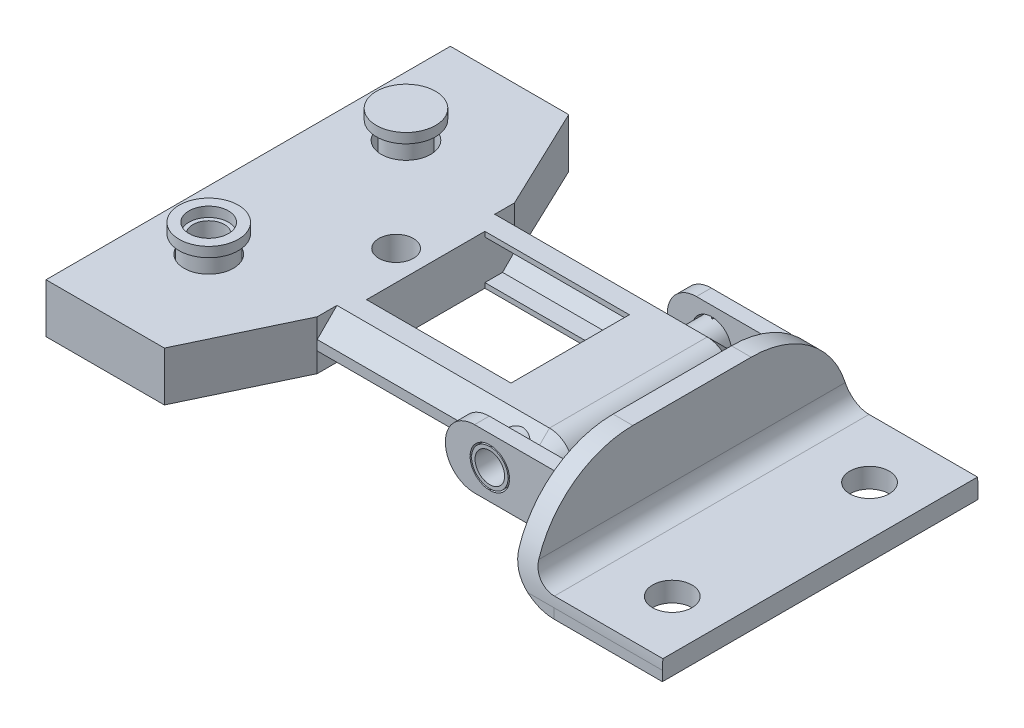
from build123d import *

# Parameters (mm, degrees)
SKETCH1_W                        = 15
SKETCH1_H                        = 32
BASE_FLANGE1_DEPTH               = 2
EDGE_FLANGE1_STRIP_W             = 12
EDGE_FLANGE1_STRIP_H             = 2
EDGE_FLANGE1_STRIP_CUT_DEPTH     = 32
EDGE_FLANGE1_DEPTH               = 32
FILLET1_R                        = 10
BOSS_EXTRUDE1_START              = 10.5
BOSS_EXTRUDE1_DEPTH              = 1.5
SKETCH12_R                       = 2
CUT_EXTRUDE1_DEPTH               = 1.5
F_4_0_4_DIAMETER_HOLE1_OUTLINE_R = 2
F_4_0_4_DIAMETER_HOLE1_DEPTH     = 2
BOSS_EXTRUDE2_DEPTH              = 10
SKETCH20_R                       = 1.85
BOSS_EXTRUDE3_DEPTH              = 12
SKETCH21_W                       = 20
SKETCH21_H                       = 5
BOSS_EXTRUDE4_DEPTH              = 15
FILLET3_SIZE                     = 2
SKETCH22_W                       = 0.147498436
SKETCH22_H                       = 0.1
BOSS_EXTRUDE5_DEPTH              = 1.5
SKETCH22_W_2                     = 0.1
SKETCH22_H_2                     = 0.147498436
BOSS_EXTRUDE5_2_DEPTH            = 1.5
BOSS_EXTRUDE5_3_DEPTH            = 1.5
BOSS_EXTRUDE5_4_DEPTH            = 1.5
SKETCH23_W                       = 0.1
SKETCH23_H                       = 0.147498436
BOSS_EXTRUDE6_DEPTH              = 1.5
SKETCH23_W_2                     = 0.147498436
SKETCH23_H_2                     = 0.1
BOSS_EXTRUDE6_2_DEPTH            = 1.5
BOSS_EXTRUDE6_3_DEPTH            = 1.5
BOSS_EXTRUDE6_4_DEPTH            = 1.5
BOSS_EXTRUDE7_START              = 3.55
BOSS_EXTRUDE7_DEPTH              = 5
F_5_0_START                      = 3.55
F_5_0_5_DIAMETER_HOLE1_OUTLINE_R = 2.5
F_5_0_5_DIAMETER_HOLE1_DEPTH     = 5
SKETCH33_R                       = 1.5
CUT_EXTRUDE2_DEPTH               = 24
SKETCH34_R                       = 3.5
SKETCH34_R_2                     = 2.5
CUT_EXTRUDE3_DEPTH               = 2
SKETCH35_R                       = 3
BOSS_EXTRUDE8_DEPTH              = 1.5
BOSS_EXTRUDE8_2_DEPTH            = 1.5
SKETCH36_R                       = 2
BOSS_EXTRUDE9_DEPTH              = 6.3
SKETCH37_R                       = 3
BOSS_EXTRUDE10_DEPTH             = 1
SKETCH38_R                       = 3.5
CUT_EXTRUDE5_DEPTH               = 3.45
SKETCH39_R                       = 2
CUT_EXTRUDE6_DEPTH               = 7.8
SKETCH40_R                       = 2.4
SKETCH40_R_2                     = 1.6
EXTRUDE_THIN1_DEPTH              = 3.35
SKETCH41_R                       = 1.75
CUT_EXTRUDE7_DEPTH               = 10
SKETCH42_W                       = 14.65
SKETCH42_H                       = 12
CUT_EXTRUDE8_DEPTH               = 56.168854453
CUT_EXTRUDE10_DEPTH              = 14.65


# Read off the part's stored shape, not the designer's step: Ø4.0 (4) Diameter Hole1, Ø5.0 (5) Diameter Hole1
# Sheet-metal steps are written as plain solids
with BuildPart() as part:
    # Sketch1 → Base-Flange1 (new body)
    with BuildSketch(Plane(origin=(0, 0, 0), x_dir=(1, 0, 0), z_dir=(0, 1, 0))):
        Rectangle(SKETCH1_W, SKETCH1_H)
    extrude(amount=BASE_FLANGE1_DEPTH)

    # Edge-Flange1 strip (across the edge) → Edge-Flange1 strip cut (cut)
    with BuildSketch(Plane(origin=(-7.5, 2, -16), x_dir=(1, 0, 0), z_dir=(0, 0, 1))):
        with Locations((-2, -1)):
            Rectangle(EDGE_FLANGE1_STRIP_W, EDGE_FLANGE1_STRIP_H)
    extrude(amount=EDGE_FLANGE1_STRIP_CUT_DEPTH, mode=Mode.SUBTRACT)

    # Edge-Flange1 section (across the edge) → Edge-Flange1 (add)
    with BuildSketch(Plane(origin=(-7.5, 2, -16), x_dir=(1, 0, 0), z_dir=(0, 0, 1))):
        with BuildLine():
            Line((0, 2), (0, 9))
            Line((0, 9), (2, 9))
            Line((2, 9), (2, 2))
            ThreePointArc((2, 2), (2.585786438, 0.585786438), (4, 0))
            Line((4, 0), (4, -2))
            ThreePointArc((4, -2), (1.171572875, -0.828427125), (0, 2))
        make_face()
    extrude(amount=EDGE_FLANGE1_DEPTH)

    # Fillet1
    fillet1_edges = [part.edges().sort_by_distance(p)[0] for p in [
        (-6.5, 11, -16),
        (-6.5, 11, 16),
    ]]
    fillet(fillet1_edges, radius=FILLET1_R)

    # Sketch11 → Boss-Extrude1 (add)
    with BuildSketch(Plane.XY.offset(BOSS_EXTRUDE1_START)):
        with BuildLine():
            Line((-15.55, 9.05), (-7.5, 9.05))
            Line((-7.5, 9.05), (-7.5, 4))
            ThreePointArc((-7.5, 4), (-7.471284466, 3.521565374), (-7.385550154, 3.05))
            Line((-7.385550154, 3.05), (-7.5, 3.05))
            Line((-7.5, 3.05), (-15.55, 3.05))
            ThreePointArc((-15.55, 3.05), (-17.635965005, 3.914034995), (-18.5, 6))
            Line((-18.5, 6), (-18.5, 6.1))
            ThreePointArc((-18.5, 6.1), (-17.635965005, 8.185965005), (-15.55, 9.05))
        make_face()
    boss_extrude1 = extrude(amount=BOSS_EXTRUDE1_DEPTH)

    # Sketch12 → Cut-Extrude1 (cut)
    with BuildSketch(Plane.XY.offset(12)):
        with Locations((-14, 6.05)):
            Circle(SKETCH12_R)
    cut_extrude1 = extrude(amount=-CUT_EXTRUDE1_DEPTH, mode=Mode.SUBTRACT)

    # Mirror1: Boss-Extrude1, Cut-Extrude1 across plane
    add(boss_extrude1.mirror(Plane.XY))
    add(cut_extrude1.mirror(Plane.XY), mode=Mode.SUBTRACT)

    # Ø4.0 (4) Diameter Hole1 outline → Ø4.0 (4) Diameter Hole1 (cut)
    with BuildSketch(Plane(origin=(0, 0, 0), x_dir=(1, 0, 0), z_dir=(0, 1, 0))):
        with Locations((2.5, 10)):
            Circle(F_4_0_4_DIAMETER_HOLE1_OUTLINE_R)
        with Locations((2.5, -10)):
            Circle(F_4_0_4_DIAMETER_HOLE1_OUTLINE_R)
    extrude(amount=F_4_0_4_DIAMETER_HOLE1_DEPTH, mode=Mode.SUBTRACT)


with BuildPart() as body_2:
    # Sketch19 → Boss-Extrude2 (new, symmetric)
    with BuildSketch(Plane.XY):
        with BuildLine():
            Line((-18.5, 8.55), (-11.95, 8.55))
            ThreePointArc((-11.95, 8.55), (-10.217588386, 7.832411614), (-9.5, 6.1))
            Line((-9.5, 6.1), (-9.5, 6))
            ThreePointArc((-9.5, 6), (-10.217588386, 4.267588386), (-11.95, 3.55))
            Line((-11.95, 3.55), (-18.5, 3.55))
            Line((-18.5, 3.55), (-18.5, 8.55))
        make_face()
    extrude(amount=BOSS_EXTRUDE2_DEPTH, both=True)

    # Sketch20 → Boss-Extrude3 (add, symmetric)
    with BuildSketch(Plane.XY):
        with Locations((-14, 6.05)):
            Circle(SKETCH20_R)
    extrude(amount=BOSS_EXTRUDE3_DEPTH, both=True)

    # Sketch21 → Boss-Extrude4 (add)
    with BuildSketch(Plane.ZY.offset(18.5)):
        with Locations((0, 6.05)):
            Rectangle(SKETCH21_W, SKETCH21_H)
    extrude(amount=BOSS_EXTRUDE4_DEPTH)

    # Fillet3
    # the kernel refuses this chamfer: 2 mm, written as the material it takes off along each edge
    with BuildSketch(Plane(origin=(-11.95, 6, 10), x_dir=(1, 0, 0), z_dir=(0, 1, 0))) as fillet3_piece_1:
        Polygon((2.45 - FILLET3_SIZE, 0), (2.45, FILLET3_SIZE), (2.45, 0), align=None)
    revolve(axis=Axis((-11.95, 6, 10), (0, 0, -1)), revolution_arc=90, mode=Mode.SUBTRACT)
    with BuildSketch(Plane(origin=(-9.5, 6.1, 10), x_dir=(-0.9996219169112968, 0, 0.027495876610586487), z_dir=(0, -1, 0)), Plane(origin=(-9.5, 6.1, -10), x_dir=(0.027495876610586487, 0, 0.9996219169112968), z_dir=(0, -1, 0))) as fillet3_piece_2:
        Polygon((FILLET3_SIZE * 0.999621916911, FILLET3_SIZE * 0.0274958766106), (-FILLET3_SIZE * 0.0274958766106, FILLET3_SIZE * 0.999621916911), (0, 0), align=None)
    extrude(amount=0.1, mode=Mode.SUBTRACT)
    with BuildSketch(Plane(origin=(-11.95, 6.1, 10), x_dir=(0, 1, 0), z_dir=(-1, 0, 0))) as fillet3_piece_3:
        Polygon((2.45 - FILLET3_SIZE, 0), (2.45, FILLET3_SIZE), (2.45, 0), align=None)
    revolve(axis=Axis((-11.95, 6.1, 10), (0, 0, -1)), revolution_arc=90, mode=Mode.SUBTRACT)
    with BuildSketch(Plane(origin=(-11.95, 8.55, 10), x_dir=(0, -0.9996219169112968, 0.027495876610586487), z_dir=(-1, 0, 0))) as fillet3_piece_4_section:
        Polygon((FILLET3_SIZE * 0.999621916911, -FILLET3_SIZE * 0.0274958766106), (-FILLET3_SIZE * 0.0274958766106, -FILLET3_SIZE * 0.999621916911), (0, 0), align=None)
    fillet3_piece_4 = extrude(amount=26.693365976, mode=Mode.PRIVATE)
    fillet3_piece_4 = fillet3_piece_4 - Plane(origin=(-14, 6.05, 9.32830341), x_dir=(1, 0, 0), z_dir=(0, 0, 1)) * Cylinder(1.85, 62, mode=Mode.PRIVATE)
    add(fillet3_piece_4, mode=Mode.SUBTRACT)
    with BuildSketch(Plane(origin=(-38.643365976, 8.55, -10), x_dir=(0, 0.027495876610586487, 0.9996219169112968), z_dir=(1, 0, 0))) as fillet3_piece_5_section:
        Polygon((FILLET3_SIZE * 0.999621916911, FILLET3_SIZE * 0.0274958766106), (-FILLET3_SIZE * 0.0274958766106, FILLET3_SIZE * 0.999621916911), (0, 0), align=None)
    fillet3_piece_5 = extrude(amount=26.693365976, mode=Mode.PRIVATE)
    fillet3_piece_5 = fillet3_piece_5 - Plane(origin=(-14, 6.05, -9.328303383), x_dir=(1, 0, 0), z_dir=(0, 0, 1)) * Cylinder(1.85, 62, mode=Mode.PRIVATE)
    add(fillet3_piece_5, mode=Mode.SUBTRACT)
    with BuildSketch(Plane(origin=(-11.95, 6.1, -10), x_dir=(0, 1, 0), z_dir=(-1, 0, 0))) as fillet3_piece_6:
        Polygon((2.45, -FILLET3_SIZE), (2.45 - FILLET3_SIZE, 0), (2.45, 0), align=None)
    revolve(axis=Axis((-11.95, 6.1, -10), (0, 0, -1)), revolution_arc=90, mode=Mode.SUBTRACT)
    with BuildSketch(Plane(origin=(-11.95, 6, -10), x_dir=(1, 0, 0), z_dir=(0, 1, 0))) as fillet3_piece_7:
        Polygon((2.45 - FILLET3_SIZE, 0), (2.45, -FILLET3_SIZE), (2.45, 0), align=None)
    revolve(axis=Axis((-11.95, 6, -10), (0, 0, -1)), revolution_arc=90, mode=Mode.SUBTRACT)
    with BuildSketch(Plane(origin=(-38.643365976, 3.55, -10), x_dir=(0, -0.02749587661058627, 0.9996219169112968), z_dir=(1, 0, 0))) as fillet3_piece_8_section:
        Polygon((FILLET3_SIZE * 0.999621916911, -FILLET3_SIZE * 0.0274958766106), (-FILLET3_SIZE * 0.0274958766106, -FILLET3_SIZE * 0.999621916911), (0, 0), align=None)
    fillet3_piece_8 = extrude(amount=26.693365976, mode=Mode.PRIVATE)
    fillet3_piece_8 = fillet3_piece_8 - Plane(origin=(-14, 6.05, -9.328303378), x_dir=(1, 0, 0), z_dir=(0, 0, 1)) * Cylinder(1.85, 62, mode=Mode.PRIVATE)
    add(fillet3_piece_8, mode=Mode.SUBTRACT)
    with BuildSketch(Plane(origin=(-11.95, 3.55, 10), x_dir=(0, -0.027495876610586487, -0.9996219169112968), z_dir=(-1, 0, 0))) as fillet3_piece_9_section:
        Polygon((FILLET3_SIZE * 0.999621916911, -FILLET3_SIZE * 0.0274958766106), (-FILLET3_SIZE * 0.0274958766106, -FILLET3_SIZE * 0.999621916911), (0, 0), align=None)
    fillet3_piece_9 = extrude(amount=26.693365976, mode=Mode.PRIVATE)
    fillet3_piece_9 = fillet3_piece_9 - Plane(origin=(-14, 6.05, 9.328303378), x_dir=(1, 0, 0), z_dir=(0, 0, 1)) * Cylinder(1.85, 62, mode=Mode.PRIVATE)
    add(fillet3_piece_9, mode=Mode.SUBTRACT)

    # Sketch25 → Boss-Extrude7 (add)
    with BuildSketch(Plane(origin=(0, 0, 0), x_dir=(1, 0, 0), z_dir=(0, 1, 0)).offset(BOSS_EXTRUDE7_START)):
        Polygon((-50.5, 20.5), (-38.5, 20.5), (-33.5, 10), (-33.5, -10), (-38.5, -20.5), (-50.5, -20.5), align=None)
    extrude(amount=BOSS_EXTRUDE7_DEPTH)

    # Ø5.0 (5) Diameter Hole1 outline → Ø5.0 (5) Diameter Hole1 (cut)
    with BuildSketch(Plane(origin=(0, 0, 0), x_dir=(1, 0, 0), z_dir=(0, 1, 0)).offset(F_5_0_START)):
        with Locations((-44.5, -10)):
            Circle(F_5_0_5_DIAMETER_HOLE1_OUTLINE_R)
        with Locations((-44.5, 10)):
            Circle(F_5_0_5_DIAMETER_HOLE1_OUTLINE_R)
    extrude(amount=F_5_0_5_DIAMETER_HOLE1_DEPTH, mode=Mode.SUBTRACT)

    # Sketch33 → Cut-Extrude2 (cut)
    with BuildSketch(Plane(origin=(0, 0, -12), x_dir=(-1, 0, 0), z_dir=(0, 0, -1))):
        with Locations((14, 6.05)):
            Circle(SKETCH33_R)
    extrude(amount=-CUT_EXTRUDE2_DEPTH, mode=Mode.SUBTRACT)

    # Sketch34 → Cut-Extrude3 (cut)
    # profile 1 of 2: a face of its own
    with BuildSketch(Plane.XZ.offset(-3.55)):
        with Locations(Location((-44.5, -10, 0), (0, 0, 270))):
            Circle(SKETCH34_R)
        with Locations(Location((-44.5, -10, 0), (0, 0, 90))):
            Circle(SKETCH34_R_2, mode=Mode.SUBTRACT)
    # profile 2 of 2: a face of its own
    with BuildSketch(Plane.XZ.offset(-3.55)):
        with Locations(Location((-44.5, 10, 0), (0, 0, 270))):
            Circle(SKETCH34_R)
        with Locations(Location((-44.5, 10, 0), (0, 0, 90))):
            Circle(SKETCH34_R_2, mode=Mode.SUBTRACT)
    extrude(amount=-CUT_EXTRUDE3_DEPTH, mode=Mode.SUBTRACT)


with BuildPart() as body_3:
    # Sketch22 → Boss-Extrude5 (new body)
    with BuildSketch(Plane(origin=(0, 0, -12), x_dir=(-1, 0, 0), z_dir=(0, 0, -1))):
        with Locations((12.076250782, 6)):
            Rectangle(SKETCH22_W, SKETCH22_H)
    extrude(amount=-BOSS_EXTRUDE5_DEPTH)


with BuildPart() as body_4:
    # Sketch22 → Boss-Extrude5 2 (new body)
    with BuildSketch(Plane(origin=(0, 0, -12), x_dir=(-1, 0, 0), z_dir=(0, 0, -1))):
        with Locations((13.95, 7.973749218)):
            Rectangle(SKETCH22_W_2, SKETCH22_H_2)
    extrude(amount=-BOSS_EXTRUDE5_2_DEPTH)


with BuildPart() as body_5:
    # Sketch22 → Boss-Extrude5 3 (new body)
    with BuildSketch(Plane(origin=(0, 0, -12), x_dir=(-1, 0, 0), z_dir=(0, 0, -1))):
        with Locations((15.923749218, 6.1)):
            Rectangle(SKETCH22_W, SKETCH22_H)
    extrude(amount=-BOSS_EXTRUDE5_3_DEPTH)


with BuildPart() as body_6:
    # Sketch22 → Boss-Extrude5 4 (new body)
    with BuildSketch(Plane(origin=(0, 0, -12), x_dir=(-1, 0, 0), z_dir=(0, 0, -1))):
        with Locations((14.05, 4.126250782)):
            Rectangle(SKETCH22_W_2, SKETCH22_H_2)
    extrude(amount=-BOSS_EXTRUDE5_4_DEPTH)


with BuildPart() as body_7:
    # Sketch23 → Boss-Extrude6 (new body)
    with BuildSketch(Plane.XY.offset(12)):
        with Locations((-13.95, 7.973749218)):
            Rectangle(SKETCH23_W, SKETCH23_H)
    extrude(amount=-BOSS_EXTRUDE6_DEPTH)


with BuildPart() as body_8:
    # Sketch23 → Boss-Extrude6 2 (new body)
    with BuildSketch(Plane.XY.offset(12)):
        with Locations((-12.076250782, 6)):
            Rectangle(SKETCH23_W_2, SKETCH23_H_2)
    extrude(amount=-BOSS_EXTRUDE6_2_DEPTH)


with BuildPart() as body_9:
    # Sketch23 → Boss-Extrude6 3 (new body)
    with BuildSketch(Plane.XY.offset(12)):
        with Locations((-14.05, 4.126250782)):
            Rectangle(SKETCH23_W, SKETCH23_H)
    extrude(amount=-BOSS_EXTRUDE6_3_DEPTH)


with BuildPart() as body_10:
    # Sketch23 → Boss-Extrude6 4 (new body)
    with BuildSketch(Plane.XY.offset(12)):
        with Locations((-15.923749218, 6.1)):
            Rectangle(SKETCH23_W_2, SKETCH23_H_2)
    extrude(amount=-BOSS_EXTRUDE6_4_DEPTH)


with BuildPart() as body_11:
    # Sketch35 → Boss-Extrude8 (new body)
    with BuildSketch(Plane.XZ.offset(-3.55)):
        with Locations(Location((-44.5, -10, 0), (0, 0, 90))):
            Circle(SKETCH35_R)
    extrude(amount=-BOSS_EXTRUDE8_DEPTH)


with BuildPart() as body_12:
    # Sketch35 → Boss-Extrude8 2 (new body)
    with BuildSketch(Plane.XZ.offset(-3.55)):
        with Locations(Location((-44.5, 10, 0), (0, 0, 270))):
            Circle(SKETCH35_R)
    extrude(amount=-BOSS_EXTRUDE8_2_DEPTH)

    # Sketch36 → Boss-Extrude9 (add)
    with BuildSketch(Plane(origin=(0, 5.05, 0), x_dir=(1, 0, 0), z_dir=(0, 1, 0))):
        with Locations(Location((-44.5, 10, 0), (0, 0, 90))):
            Circle(SKETCH36_R)
        with Locations(Location((-44.5, -10, 0), (0, 0, 270))):
            Circle(SKETCH36_R)
    extrude(amount=BOSS_EXTRUDE9_DEPTH)


with BuildPart() as boss_extrude9_piece_1:
    # of the separate pieces the step leaves, piece 1, a body of its own (boss_extrude9_pieces)
    add(body_12.part.solids().sort_by_distance((-44.5, 3.55, 7))[0])



with BuildPart() as boss_extrude9_piece_2:
    # of the separate pieces the step leaves, piece 2, a body of its own (boss_extrude9_pieces)
    add(body_12.part.solids().sort_by_distance((-44.5, 5.05, -12))[0])


with BuildPart() as boss_extrude9_piece_1_1:
    add(boss_extrude9_piece_1.part)

    add(boss_extrude9_piece_2.part)  # Boss-Extrude10 merges Boss-Extrude9 piece 2
    # Sketch37 → Boss-Extrude10 (add)
    with BuildSketch(Plane(origin=(0, 11.35, 0), x_dir=(1, 0, 0), z_dir=(0, 1, 0))):
        with Locations(Location((-44.5, 10, 0), (0, 0, 90))):
            Circle(SKETCH37_R)
        with Locations(Location((-44.5, -10, 0), (0, 0, 90))):
            Circle(SKETCH37_R)
    extrude(amount=-BOSS_EXTRUDE10_DEPTH)


with BuildPart() as cut_extrude5_tool:
    # Sketch38 → Cut-Extrude5 (new body)
    with BuildSketch(Plane.XZ.offset(-3.55)):
        with Locations(Location((-44.5, 10, 0), (0, 0, 270))):
            Circle(SKETCH38_R)
    extrude(amount=-CUT_EXTRUDE5_DEPTH)


with BuildPart() as body_2_1:
    add(body_2.part)

    # Cut-Extrude5: cut by cut_extrude5_tool
    add(cut_extrude5_tool.part, mode=Mode.SUBTRACT)

    # Sketch41 → Cut-Extrude7 (cut)
    with BuildSketch(Plane(origin=(0, 8.55, 0), x_dir=(1, 0, 0), z_dir=(0, 1, 0))):
        with Locations(Location((-35.5, 0, 0), (0, 0, 270))):
            Circle(SKETCH41_R)
    extrude(amount=-CUT_EXTRUDE7_DEPTH, mode=Mode.SUBTRACT)

    # Sketch42 → Cut-Extrude8 (cut, through all)
    with BuildSketch(Plane(origin=(0, 8.55, 0), x_dir=(1, 0, 0), z_dir=(0, 1, 0))):
        with Locations((-25.175, 0)):
            Rectangle(SKETCH42_W, SKETCH42_H)
    extrude(amount=-CUT_EXTRUDE8_DEPTH, mode=Mode.SUBTRACT)

    # Sketch48 → Cut-Extrude10 (cut)
    with BuildSketch(Plane(origin=(-32.5, 0, 0), x_dir=(0, 0, -1), z_dir=(1, 0, 0))):
        Polygon((7.792893219, 4.05), (9.5, 5.757106781), (9.5, 6.342893219), (7.792893219, 8.05), (5.5, 8.05), (5.5, 4.05), align=None)
        Polygon((-7.792893219, 4.05), (-5.5, 4.05), (-5.5, 8.05), (-7.792893219, 8.05), (-9.5, 6.342893219), (-9.5, 5.757106781), align=None)
    extrude(amount=CUT_EXTRUDE10_DEPTH, mode=Mode.SUBTRACT)


with BuildPart() as boss_extrude9_piece_1_2:
    add(boss_extrude9_piece_1_1.part)

    # Cut-Extrude5: cut by cut_extrude5_tool
    add(cut_extrude5_tool.part, mode=Mode.SUBTRACT)

    # Sketch39 → Cut-Extrude6 (cut)
    with BuildSketch(Plane.XZ.offset(-3.55)):
        with Locations(Location((-44.5, 10, 0), (0, 0, 90))):
            Circle(SKETCH39_R)
    extrude(amount=-CUT_EXTRUDE6_DEPTH, mode=Mode.SUBTRACT)

    # Sketch40 → Extrude-Thin1 (add)
    with BuildSketch(Plane.XZ.offset(-10.35)):
        with Locations((-44.5, 10)):
            Circle(SKETCH40_R)
        with Locations((-44.5, 10)):
            Circle(SKETCH40_R_2, mode=Mode.SUBTRACT)
    extrude(amount=EXTRUDE_THIN1_DEPTH)


solid = Compound([part.part, body_3.part, body_4.part, body_5.part, body_6.part, body_7.part, body_8.part, body_9.part, body_10.part, body_11.part, body_2_1.part, boss_extrude9_piece_1_2.part])
